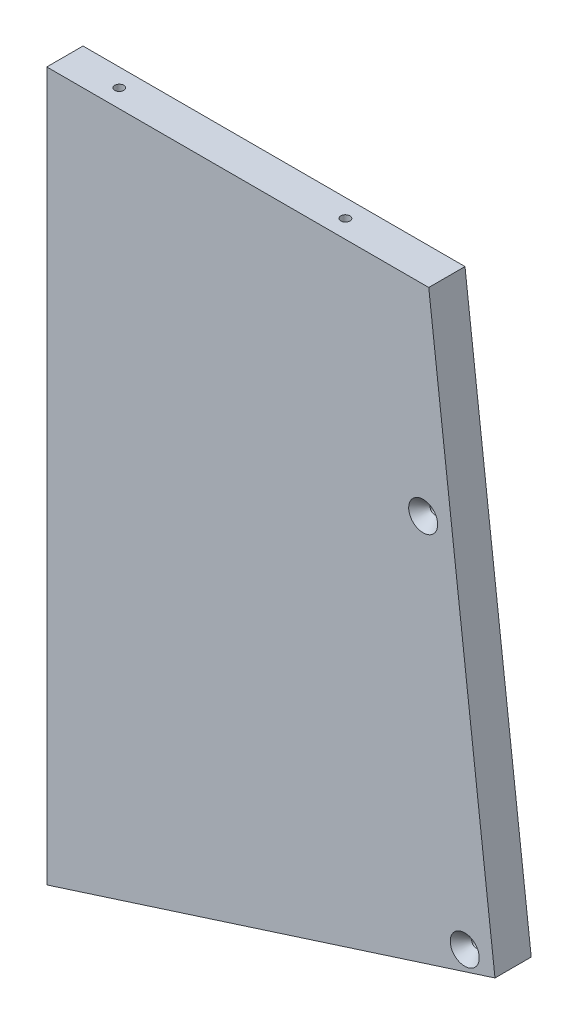
from build123d import *

# Parameters (mm, degrees)
BOSS_EXTRUDE1_DEPTH = 12.7
HOLE3_D             = 3.175
HOLE3_DEPTH         = 31.75
HOLE3_CSINK_D       = 10.16
HOLE3_CSINK_ANGLE   = 82
HOLE3_TIP           = 0.953866233
HOLE6_D             = 3.175
HOLE6_DEPTH         = 38.1
HOLE6_CSINK_D       = 10.16
HOLE6_CSINK_ANGLE   = 82
HOLE6_TIP           = 0.953866233
HOLE7_D             = 3.175
HOLE7_DEPTH         = 31.75
HOLE7_CSINK_D       = 10.16
HOLE7_CSINK_ANGLE   = 82
HOLE7_TIP           = 0.953866233
HOLE8_D             = 3.175
HOLE8_DEPTH         = 31.75
HOLE8_CSINK_D       = 10.16
HOLE8_CSINK_ANGLE   = 82
HOLE8_TIP           = 0.953866233


with BuildPart() as part:
    # Sketch1 → Boss-Extrude1 (new body)
    with BuildSketch(Plane.XY):
        Polygon((-88.190159952, 0), (-222.052967181, 0), (-222.052967181, -248.25), (-64.977416983, -197.966048293), align=None)
    extrude(amount=-BOSS_EXTRUDE1_DEPTH)

    # Hole3
    with Locations(Plane(origin=(-234.752967181, 1057.986945614, -135.816741379), x_dir=(0, 0, -1), z_dir=(-1, 0, 0))):
        with Locations((-129.466741379, 1300.662770337), (-129.466741379, 1128.612770337), (129.198788767, 1128.612770337), (129.198788767, 1300.662770337)):
            CounterSinkHole(HOLE3_D / 2, HOLE3_CSINK_D / 2, depth=HOLE3_DEPTH, counter_sink_angle=HOLE3_CSINK_ANGLE)
            with Locations((0, 0, -(HOLE3_DEPTH + HOLE3_TIP / 2))):  # 118° drill point
                Cone(0, HOLE3_D / 2, HOLE3_TIP, mode=Mode.SUBTRACT)

    # Hole6
    with Locations(Plane(origin=(181.039434513, 1057.986945614, 0), x_dir=(-0.9271838545667885, -0.3746065934159093, 0), z_dir=(0, 0, 1))):
        with Locations((707.166557203, 1065.270372796), (674.127983646, 944.603090451)):
            CounterSinkHole(HOLE6_D / 2, HOLE6_CSINK_D / 2, depth=HOLE6_DEPTH, counter_sink_angle=HOLE6_CSINK_ANGLE)
            with Locations((0, 0, -(HOLE6_DEPTH + HOLE6_TIP / 2))):  # 118° drill point
                Cone(0, HOLE6_D / 2, HOLE6_TIP, mode=Mode.SUBTRACT)

    # Hole7
    with Locations(Plane(origin=(181.039434513, 12.7, -135.816741379), x_dir=(0, 0, -1), z_dir=(0, 1, 0))):
        with Locations((129.198788767, 384.042401694), (-129.466741379, 384.042401694), (-129.466741379, 304.786761906), (-110.416741379, 409.442401694), (-0.133976306, 409.442401694), (110.148788767, 409.442401694), (129.198788767, 304.786761906)):
            CounterSinkHole(HOLE7_D / 2, HOLE7_CSINK_D / 2, depth=HOLE7_DEPTH, counter_sink_angle=HOLE7_CSINK_ANGLE)
            with Locations((0, 0, -(HOLE7_DEPTH + HOLE7_TIP / 2))):  # 118° drill point
                Cone(0, HOLE7_D / 2, HOLE7_TIP, mode=Mode.SUBTRACT)

    # Hole8
    with Locations(Plane(origin=(526.732567938, -21.879240084, -135.816741379), x_dir=(0, 0, 1), z_dir=(0.3048844921716131, -0.9523893355310409, 0))):
        with Locations((-129.257383629, 756.347108024), (129.466741379, 658.326331022), (129.466741379, 756.147636988), (-129.408220012, 658.52591835)):
            CounterSinkHole(HOLE8_D / 2, HOLE8_CSINK_D / 2, depth=HOLE8_DEPTH, counter_sink_angle=HOLE8_CSINK_ANGLE)
            with Locations((0, 0, -(HOLE8_DEPTH + HOLE8_TIP / 2))):  # 118° drill point
                Cone(0, HOLE8_D / 2, HOLE8_TIP, mode=Mode.SUBTRACT)


solid = part.part
